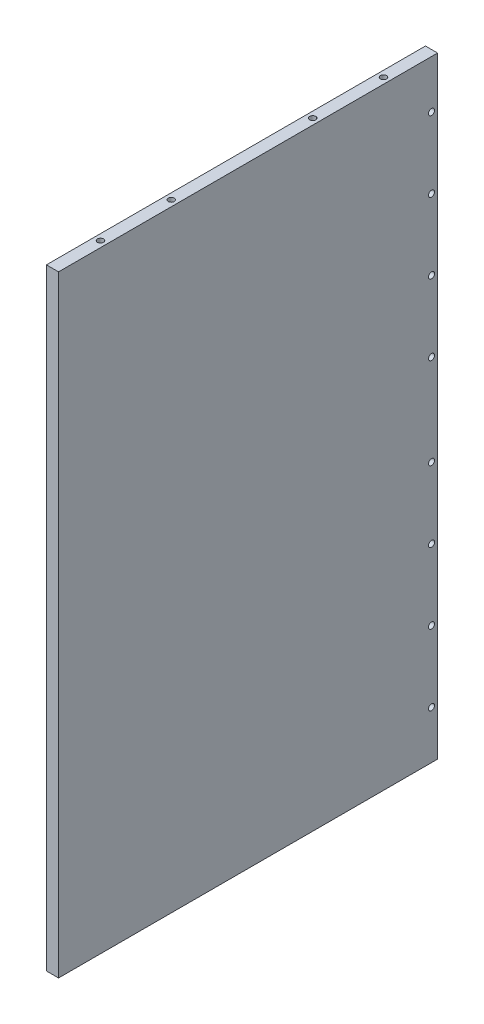
from build123d import *

# Parameters (mm, degrees)
CROQUIS2_W              = 375
CROQUIS2_H              = 605
SALIENTE_EXTRUIR1_DEPTH = 6
CROQUIS3_R              = 3
CORTAR_EXTRUIR1_DEPTH   = 23
CROQUIS6_R              = 3
CORTAR_EXTRUIR2_DEPTH   = 5


with BuildPart() as part:
    # Croquis2 → Saliente-Extruir1 (new, symmetric)
    with BuildSketch(Plane(origin=(0, 0, 0), x_dir=(0, 0, -1), z_dir=(1, 0, 0))):
        Rectangle(CROQUIS2_W, CROQUIS2_H)
    extrude(amount=SALIENTE_EXTRUIR1_DEPTH, both=True)

    # Croquis3 → Cortar-Extruir1 (cut)
    with BuildSketch(Plane(origin=(0, 302.5, 0), x_dir=(1, 0, 0), z_dir=(0, 1, 0))):
        with Locations((0, 140)):
            Circle(CROQUIS3_R)
        with Locations((0, 70)):
            Circle(CROQUIS3_R)
        with Locations((0, -70)):
            Circle(CROQUIS3_R)
        with Locations((0, -140)):
            Circle(CROQUIS3_R)
    cortar_extruir1 = extrude(amount=-CORTAR_EXTRUIR1_DEPTH, mode=Mode.SUBTRACT)

    # Simetría1: Cortar-Extruir1 across plane
    add(cortar_extruir1.mirror(Plane.ZX), mode=Mode.SUBTRACT)

    # Croquis6 → Cortar-Extruir2 (cut)
    with BuildSketch(Plane(origin=(6, 0, 0), x_dir=(0, 0, -1), z_dir=(1, 0, 0))):
        with Locations((181.5, -255)):
            Circle(CROQUIS6_R)
        with Locations((181.5, -185)):
            Circle(CROQUIS6_R)
        with Locations((181.5, -115)):
            Circle(CROQUIS6_R)
        with Locations((181.5, -45)):
            Circle(CROQUIS6_R)
        with Locations((181.5, 45)):
            Circle(CROQUIS6_R)
        with Locations((181.5, 115)):
            Circle(CROQUIS6_R)
        with Locations((181.5, 185)):
            Circle(CROQUIS6_R)
        with Locations((181.5, 255)):
            Circle(CROQUIS6_R)
    extrude(amount=-CORTAR_EXTRUIR2_DEPTH, mode=Mode.SUBTRACT)


solid = part.part
